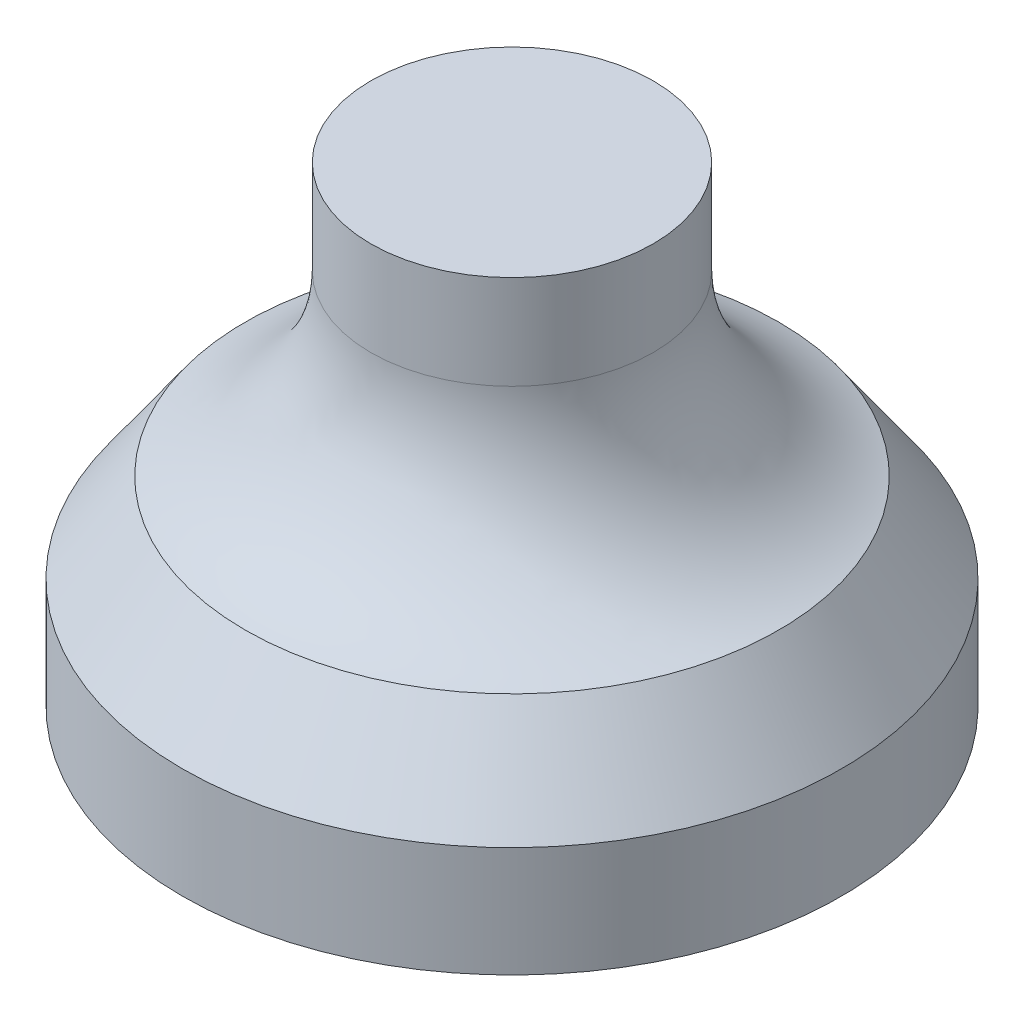
from build123d import *

# Parameters (mm, degrees)
SCHIZZO1_R                   = 35
ESTRUSIONE_ESTRUSIONE1_DEPTH = 20
SCHIZZO2_R                   = 15
ESTRUSIONE_ESTRUSIONE2_DEPTH = 30
RACCORDO1_R                  = 20


with BuildPart() as part:
    # Schizzo1 → Estrusione-Estrusione1 (new body)
    with BuildSketch(Plane(origin=(0, 0, 0), x_dir=(1, 0, 0), z_dir=(0, 1, 0))):
        with Locations(Location((0, 0, 0), (0, 0, 270))):
            Circle(SCHIZZO1_R)
    extrude(amount=ESTRUSIONE_ESTRUSIONE1_DEPTH)

    # Schizzo2 → Estrusione-Estrusione2 (add)
    with BuildSketch(Plane(origin=(0, 20, 0), x_dir=(1, 0, 0), z_dir=(0, 1, 0))):
        with Locations(Location((0, 0, 0), (0, 0, 270))):
            Circle(SCHIZZO2_R)
    extrude(amount=ESTRUSIONE_ESTRUSIONE2_DEPTH)

    # Raccordo1
    raccordo1_edges = [part.edges().sort_by_distance(p)[0] for p in [
        (0, 20, -15),
    ]]
    fillet(raccordo1_edges, radius=RACCORDO1_R - 0.0001)  # a hair under: the kernel refuses the full size

    # Smusso1: read off the stored shape, not the designer's step
    # Smusso1 outline → Smusso1 (revolve, cut)
    with BuildSketch(Plane.XY):
        Polygon((35, 21.143819168), (28.333333333, 21.143819168), (35, 11.715728753), align=None)
    revolve(axis=Axis((0, 0, 0), (0, 1, 0)), mode=Mode.SUBTRACT)


solid = part.part
